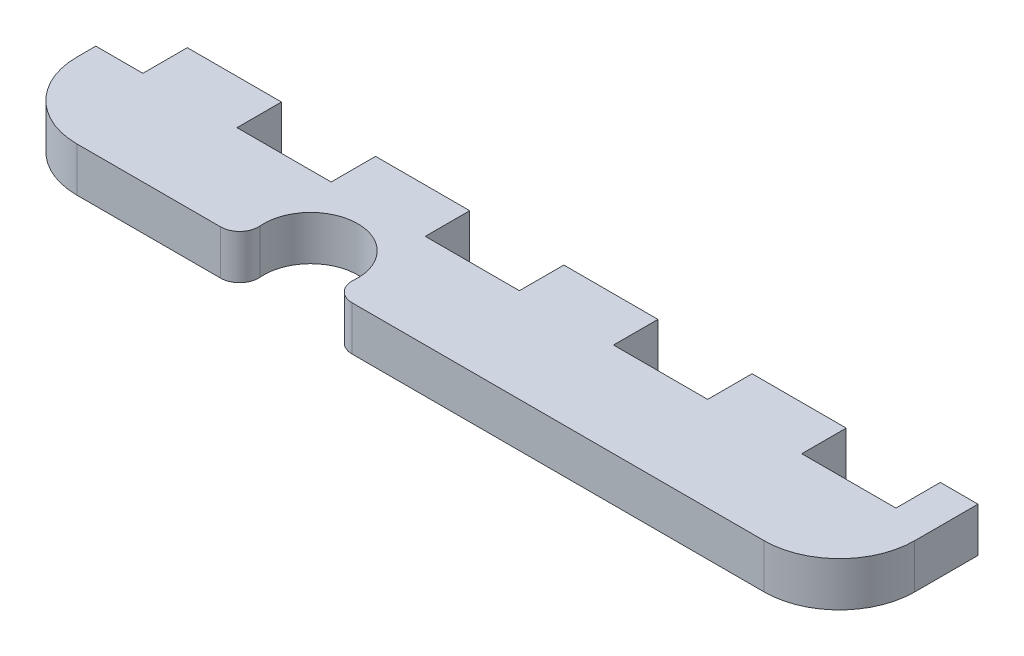
from build123d import *

# Parameters (mm, degrees)
BOSS_EXTRUDE1_DEPTH = 5.9944


with BuildPart() as part:
    # Sketch1 → Boss-Extrude1 (new body)
    with BuildSketch(Plane(origin=(0, 0, 0), x_dir=(1, 0, 0), z_dir=(0, 1, 0))):
        with BuildLine():
            Line((0, 0), (12.7, 0))
            Line((12.7, 0), (12.7, -5.9944))
            Line((12.7, -5.9944), (25.4, -5.9944))
            Line((25.4, -5.9944), (25.4, 0))
            Line((25.4, 0), (38.1, 0))
            Line((38.1, 0), (38.1, -5.9944))
            Line((38.1, -5.9944), (50.8, -5.9944))
            Line((50.8, -5.9944), (50.8, 0))
            Line((50.8, 0), (63.5, 0))
            Line((63.5, 0), (63.5, -5.9944))
            Line((63.5, -5.9944), (76.2, -5.9944))
            Line((76.2, -5.9944), (76.2, 0))
            Line((76.2, 0), (88.9, 0))
            Line((88.9, 0), (88.9, -5.9944))
            Line((88.9, -5.9944), (101.6, -5.9944))
            Line((101.6, -5.9944), (101.6, 0))
            Line((101.6, 0), (106.68, 0))
            Line((106.68, 0), (106.68, -5.9944))
            Line((106.68, -5.9944), (106.68, -8.5344))
            ThreePointArc((106.68, -8.5344), (103.704204897, -15.718604897), (96.52, -18.6944))
            Line((96.52, -18.6944), (40.920907051, -18.6944))
            ThreePointArc((40.920907051, -18.6944), (39.051894592, -17.874397799), (38.389649322, -15.943842857))
            ThreePointArc((38.389649322, -15.943842857), (32.061505, -9.06745), (25.733360678, -15.943842857))
            ThreePointArc((25.733360678, -15.943842857), (25.071115408, -17.874397799), (23.202102949, -18.6944))
            Line((23.202102949, -18.6944), (3.81, -18.6944))
            ThreePointArc((3.81, -18.6944), (-3.374204897, -15.718604897), (-6.35, -8.5344))
            Line((-6.35, -8.5344), (-6.35, -5.9944))
            Line((-6.35, -5.9944), (0, -5.9944))
            Line((0, -5.9944), (0, 0))
        make_face()
    extrude(amount=BOSS_EXTRUDE1_DEPTH)


solid = part.part
